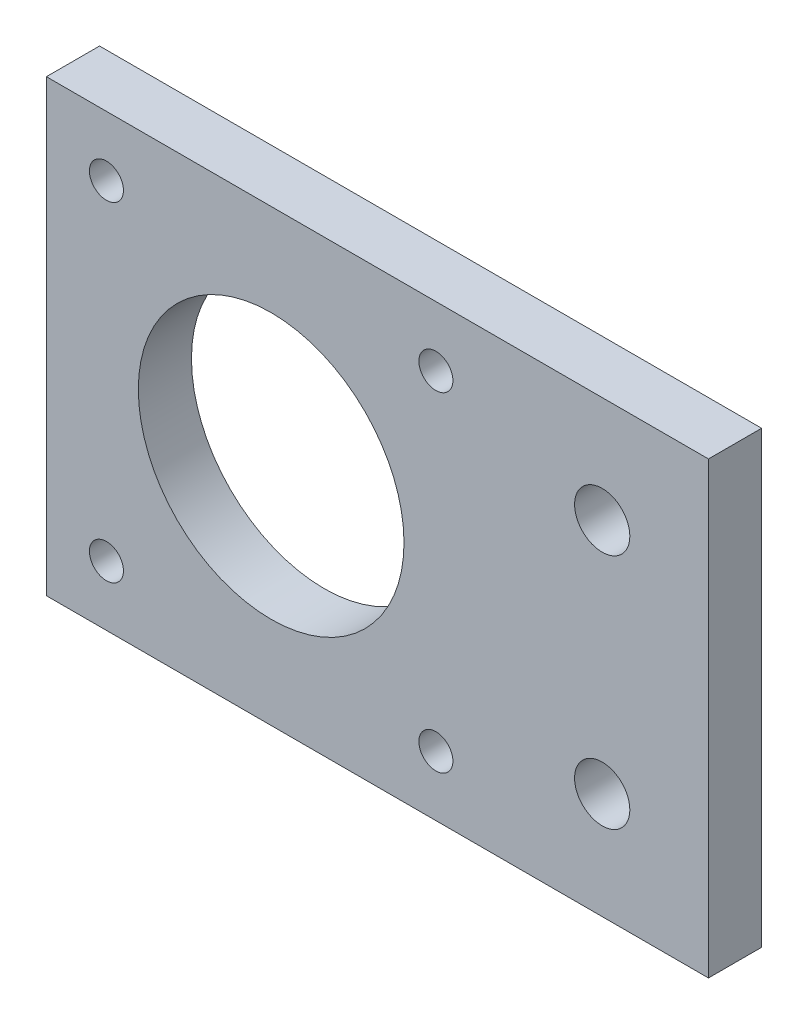
from build123d import *

# Parameters (mm, degrees)
SKETCH2_W           = 62.3
SKETCH2_H           = 42.3
SKETCH2_R           = 1.6
SKETCH2_R_2         = 2.6
BOSS_EXTRUDE1_DEPTH = 5
SKETCH3_R           = 12.5
CUT_EXTRUDE1_DEPTH  = 10


with BuildPart() as part:
    # Sketch2 → Boss-Extrude1 (new body)
    with BuildSketch(Plane.XY):
        with Locations((10, 0)):
            Rectangle(SKETCH2_W, SKETCH2_H)
        with Locations((-15.5, -15.5)):
            Circle(SKETCH2_R, mode=Mode.SUBTRACT)
        with Locations((15.5, -15.5)):
            Circle(SKETCH2_R, mode=Mode.SUBTRACT)
        with Locations((-15.5, 15.5)):
            Circle(SKETCH2_R, mode=Mode.SUBTRACT)
        with Locations((15.5, 15.5)):
            Circle(SKETCH2_R, mode=Mode.SUBTRACT)
        with Locations((31.15, 11.15)):
            Circle(SKETCH2_R_2, mode=Mode.SUBTRACT)
        with Locations((31.15, -11.15)):
            Circle(SKETCH2_R_2, mode=Mode.SUBTRACT)
    extrude(amount=BOSS_EXTRUDE1_DEPTH)

    # Sketch3 → Cut-Extrude1 (cut)
    with BuildSketch(Plane(origin=(0, 0, 0), x_dir=(-1, 0, 0), z_dir=(0, 0, -1))):
        Circle(SKETCH3_R)
    extrude(amount=-CUT_EXTRUDE1_DEPTH, mode=Mode.SUBTRACT)


solid = part.part
